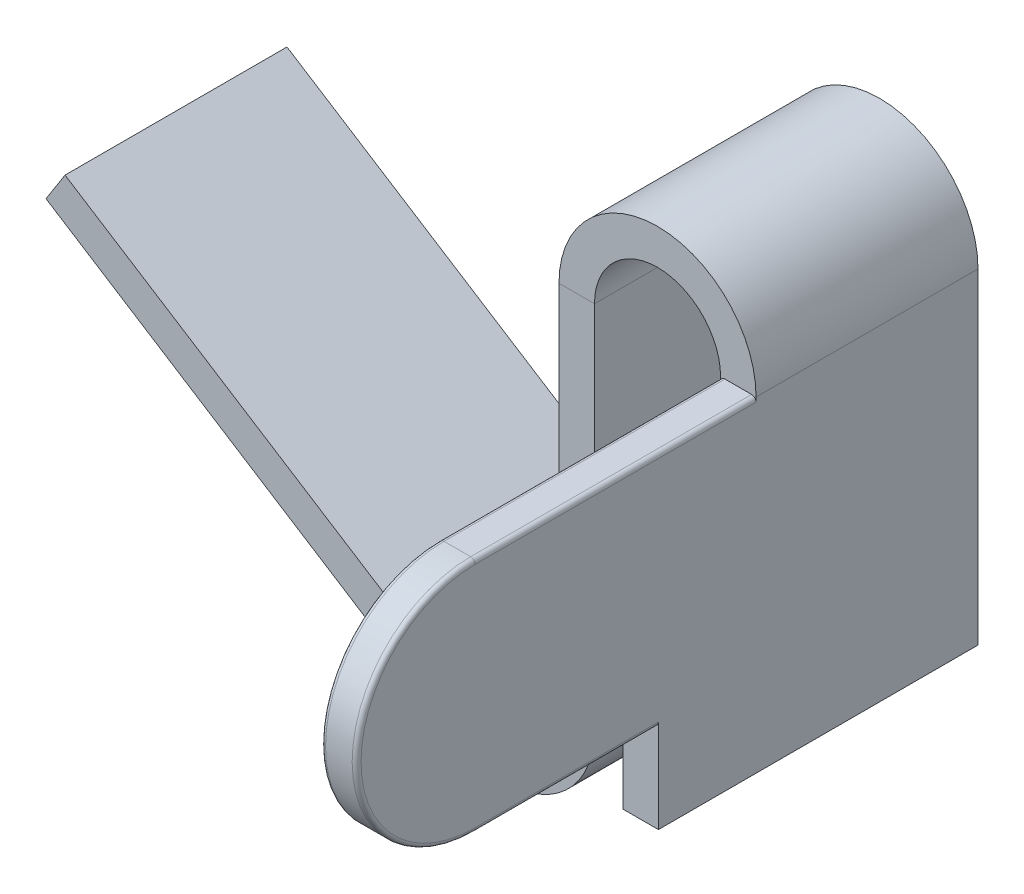
from build123d import *

# Parameters (mm, degrees)
BASE_FLANGE1_DEPTH  = 2.5
SKETCH6_W           = 0.4
SKETCH6_H           = 3.67
BOSS_EXTRUDE1_DEPTH = 4.5
SKETCH8_W           = 3.4
SKETCH8_H           = 1
CUT_EXTRUDE1_DEPTH  = 4.5
FILLET1_RADIUS      = 1.335
FILLET1_LENGTH      = 0.4
FILLET2_R           = 0.05


# Sheet-metal steps are written as plain solids
with BuildPart() as part:
    # Sketch1 → Base-Flange1 (new body)
    with BuildSketch(Plane.XY):
        with BuildLine():
            Line((0.71, -1.835), (0.71, 1.835))
            ThreePointArc((0.71, 1.835), (0, 2.545), (-0.71, 1.835))
            Line((-0.71, 1.835), (-0.71, -1.835))
            Line((-0.71, -1.835), (-0.71, -2.335))
            ThreePointArc((-0.71, -2.335), (-1.228475759, -3.211432773), (-2.246268811, -3.179047252))
            Line((-2.246268811, -3.179047252), (-6.888528694, -0.229568793))
            Line((-6.888528694, -0.229568793), (-6.67402117, 0.108050107))
            Line((-6.67402117, 0.108050107), (-2.031761286, -2.841428351))
            ThreePointArc((-2.031761286, -2.841428351), (-1.421085455, -2.860859664), (-1.11, -2.335))
            Line((-1.11, -2.335), (-1.11, -1.835))
            Line((-1.11, -1.835), (-1.11, 1.835))
            ThreePointArc((-1.11, 1.835), (0, 2.945), (1.11, 1.835))
            Line((1.11, 1.835), (1.11, -1.835))
            Line((1.11, -1.835), (0.71, -1.835))
        make_face()
    extrude(amount=BASE_FLANGE1_DEPTH)

    # Sketch6 → Boss-Extrude1 (add)
    with BuildSketch(Plane.XY.offset(2.5)):
        with Locations((0.91, 0)):
            Rectangle(SKETCH6_W, SKETCH6_H)
    extrude(amount=BOSS_EXTRUDE1_DEPTH)

    # Sketch8 → Cut-Extrude1 (cut)
    with BuildSketch(Plane(origin=(1.11, 0, 0), x_dir=(0, 0, -1), z_dir=(1, 0, 0))):
        with Locations((-5.3, -1.335)):
            Rectangle(SKETCH8_W, SKETCH8_H)
    extrude(amount=-CUT_EXTRUDE1_DEPTH, mode=Mode.SUBTRACT)

    # Fillet1: full round fillet: the end face becomes a half cylinder, R = half its width
    fillet1_face = Plane((0.91, 0.5, 7), x_dir=(-1, 0, 0), z_dir=(0, 0, 1))  # on the end face: x along it, z out of the body
    fillet1_slab = fillet1_face.offset(-FILLET1_RADIUS / 2) * Box(FILLET1_LENGTH, 2 * FILLET1_RADIUS, FILLET1_RADIUS, mode=Mode.PRIVATE)  # the body's end, R deep
    fillet1_round = Plane((0.91, 0.5, 5.665), x_dir=(0, 0, 1), z_dir=(-1, 0, 0)) * Cylinder(FILLET1_RADIUS, FILLET1_LENGTH, mode=Mode.PRIVATE)  # its axis R under the face
    add(fillet1_slab - fillet1_round, mode=Mode.SUBTRACT)

    # Fillet2
    fillet2_edges = [part.edges().sort_by_distance(p)[0] for p in [
        (1.11, -0.835, 4.6325),
        (0.71, 1.835, 4.0825),
        (1.11, 1.835, 4.0825),
        (0.71, -0.835, 4.6325),
        (0.71, 0.5, 7),
        (1.11, 0.5, 7),
    ]]
    fillet(fillet2_edges, radius=FILLET2_R)


solid = part.part
